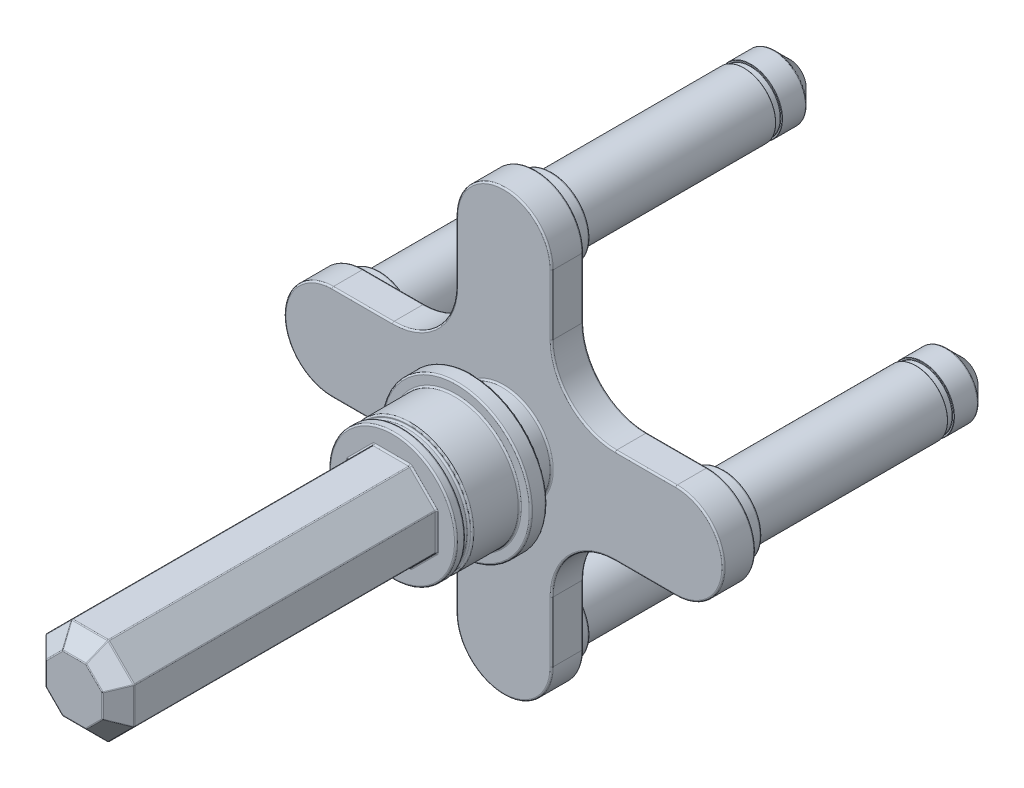
from build123d import *

# Parameters (mm, degrees)
SKETCH1_R           = 5
BOSS_EXTRUDE1_DEPTH = 5
SKETCH2_R           = 4.975
BOSS_EXTRUDE2_DEPTH = 40
SKETCH4_R           = 6
SKETCH4_R_2         = 4.975
BOSS_EXTRUDE3_DEPTH = 2.5
CIRPATTERN1_COUNT   = 4
CHAMFER1_SIZE       = 2.5
FILLET1_R           = 0.25
SKETCH5_R           = 4.975
SKETCH5_R_2         = 4.7
CUT_EXTRUDE1_DEPTH  = 0.5
CIRPATTERN3_COUNT   = 4
FILLET4_R           = 0.05
CUT_EXTRUDE2_DEPTH  = 50
CHAMFER2_SIZE       = 2.5
SKETCH9_R           = 11.75
BOSS_EXTRUDE4_DEPTH = 2.5
FILLET6_R           = 0.25
SKETCH10_R          = 10
SKETCH10_R_2        = 9.4
CUT_EXTRUDE3_DEPTH  = 0.55
FILLET7_R           = 0.25


with BuildPart() as part:
    # Sketch1 → Boss-Extrude1 (new body)
    # profile 1 of 5: a face of its own
    with BuildSketch(Plane.XY):
        with BuildLine():
            Line((-7.5, 17.5), (-7.5, 26.999999944))
            ThreePointArc((-7.5, 26.999999944), (0, 34.499999944), (7.5, 26.999999944))
            Line((7.5, 26.999999944), (7.5, 17.5))
            ThreePointArc((7.5, 17.5), (10.428932188, 10.428932188), (17.5, 7.5))
            Line((17.5, 7.5), (26.999999944, 7.5))
            ThreePointArc((26.999999944, 7.5), (34.499999944, 0), (26.999999944, -7.5))
            Line((26.999999944, -7.5), (17.5, -7.5))
            ThreePointArc((17.5, -7.5), (10.428932188, -10.428932188), (7.5, -17.5))
            Line((7.5, -17.5), (7.5, -26.999999944))
            ThreePointArc((7.5, -26.999999944), (0, -34.499999944), (-7.5, -26.999999944))
            Line((-7.5, -26.999999944), (-7.5, -17.5))
            ThreePointArc((-7.5, -17.5), (-10.428932188, -10.428932188), (-17.5, -7.5))
            Line((-17.5, -7.5), (-26.999999944, -7.5))
            ThreePointArc((-26.999999944, -7.5), (-34.499999944, 0), (-26.999999944, 7.5))
            Line((-26.999999944, 7.5), (-17.5, 7.5))
            ThreePointArc((-17.5, 7.5), (-10.428932188, 10.428932188), (-7.5, 17.5))
        make_face()
        with Locations((0, 26.999999944)):
            Circle(SKETCH1_R, mode=Mode.SUBTRACT)
        with Locations((26.999999944, 0)):
            Circle(SKETCH1_R, mode=Mode.SUBTRACT)
        with Locations((0, -26.999999944)):
            Circle(SKETCH1_R, mode=Mode.SUBTRACT)
        with Locations((-26.999999944, 0)):
            Circle(SKETCH1_R, mode=Mode.SUBTRACT)
    # profile 2 of 5: a face of its own
    with BuildSketch(Plane.XY):
        with Locations((-26.999999944, 0)):
            Circle(SKETCH1_R)
    # profile 3 of 5: a face of its own
    with BuildSketch(Plane.XY):
        with Locations((0, 26.999999944)):
            Circle(SKETCH1_R)
    # profile 4 of 5: a face of its own
    with BuildSketch(Plane.XY):
        with Locations((26.999999944, 0)):
            Circle(SKETCH1_R)
    # profile 5 of 5: a face of its own
    with BuildSketch(Plane.XY):
        with Locations((0, -26.999999944)):
            Circle(SKETCH1_R)
    extrude(amount=BOSS_EXTRUDE1_DEPTH)

    # Sketch2 → Boss-Extrude2 (add)
    with BuildSketch(Plane(origin=(0, 0, 0), x_dir=(-1, 0, 0), z_dir=(0, 0, -1))):
        with Locations(Location((-26.999999888, 5.6e-08, 0), (0, 0, 180))):
            Circle(SKETCH2_R)
        with Locations(Location((0, 27, 0), (0, 0, 180))):
            Circle(SKETCH2_R)
        with Locations(Location((27, 5.6e-08, 0), (0, 0, 180))):
            Circle(SKETCH2_R)
        with Locations(Location((1.12e-07, -26.999999944, 0), (0, 0, 180))):
            Circle(SKETCH2_R)
    extrude(amount=BOSS_EXTRUDE2_DEPTH)

    # Sketch4 → Boss-Extrude3 (add)
    with BuildSketch(Plane(origin=(0, 0, 0), x_dir=(-1, 0, 0), z_dir=(0, 0, -1))):
        with Locations(Location((0, 27, 0), (0, 0, 180))):
            Circle(SKETCH4_R)
        with Locations((0, 27)):
            Circle(SKETCH4_R_2, mode=Mode.SUBTRACT)
    boss_extrude3 = extrude(amount=BOSS_EXTRUDE3_DEPTH)

    # CirPattern1: Boss-Extrude3 ×4 about axis
    cirpattern1_axis = Axis((0, 0, 0), (0, 0, 1))
    for i in range(1, CIRPATTERN1_COUNT):
        add(boss_extrude3.rotate(cirpattern1_axis, i * 360 / CIRPATTERN1_COUNT))

    # Chamfer1
    chamfer1_edges = [part.edges().sort_by_distance(p)[0] for p in [
        (22.024999888, 5.6e-08, -40),
        (-4.975, 27, -40),
        (-31.975, 5.6e-08, -40),
        (-4.975000112, -26.999999944, -40),
    ]]
    chamfer(chamfer1_edges, length=CHAMFER1_SIZE)

    # Fillet1
    fillet1_edges = [part.edges().sort_by_distance(p)[0] for p in [
        (-10.428932188, 10.428932188, 5),
        (-29.475, 5.6e-08, -40),
        (-31.975, 5.6e-08, -37.5),
        (-2.475000112, -26.999999944, -40),
        (-4.975000112, -26.999999944, -37.5),
        (24.524999888, 5.6e-08, -40),
        (22.024999888, 5.6e-08, -37.5),
        (-2.475, 27, -40),
        (-4.975, 27, -37.5),
        (-22.249999972, 7.5, 5),
        (0, 34.499999944, 0),
        (7.5, 22.249999972, 0),
        (10.428932188, 10.428932188, 0),
        (22.249999972, 7.5, 0),
        (34.499999944, 0, 0),
        (-34.499999944, 0, 5),
        (22.249999972, -7.5, 0),
        (10.428932188, -10.428932188, 0),
        (7.5, -22.249999972, 0),
        (0, -34.499999944, 0),
        (-7.5, -22.249999972, 0),
        (-10.428932188, -10.428932188, 0),
        (-22.249999972, -7.5, 0),
        (-34.499999944, 0, 0),
        (-22.249999972, 7.5, 0),
        (-10.428932188, 10.428932188, 0),
        (-22.249999972, -7.5, 5),
        (-7.5, 22.249999972, 0),
        (-10.428932188, -10.428932188, 5),
        (-7.5, -22.249999972, 5),
        (0, -34.499999944, 5),
        (7.5, -22.249999972, 5),
        (-7.5, 22.249999972, 5),
        (10.428932188, -10.428932188, 5),
        (22.249999972, -7.5, 5),
        (34.499999944, 0, 5),
        (22.249999972, 7.5, 5),
        (10.428932188, 10.428932188, 5),
        (-6, 27, -2.5),
        (-4.975, 27, -2.5),
        (7.5, 22.249999972, 5),
        (0, 34.499999944, 5),
        (-27, -6, -2.5),
        (-31.975, -5.6e-08, -2.5),
        (6, -27, -2.5),
        (-4.975, -27, -2.5),
        (27, 6, -2.5),
        (22.025, -5.6e-08, -2.5),
    ]]
    fillet(fillet1_edges, radius=FILLET1_R)

    # Sketch5 → Cut-Extrude1 (cut, symmetric)
    with BuildSketch(Plane(origin=(0, 0, -33.25), x_dir=(-1, 0, 0), z_dir=(0, 0, -1))):
        with Locations(Location((0, 27, 0), (0, 0, 90))):
            Circle(SKETCH5_R)
        with Locations(Location((0, 27, 0), (0, 0, 90))):
            Circle(SKETCH5_R_2, mode=Mode.SUBTRACT)
    cut_extrude1 = extrude(amount=CUT_EXTRUDE1_DEPTH, both=True, mode=Mode.SUBTRACT)

    # CirPattern3: Cut-Extrude1 ×4 about axis
    cirpattern3_axis = Axis((0, 0, 0), (0, 0, 1))
    for i in range(1, CIRPATTERN3_COUNT):
        add(cut_extrude1.rotate(cirpattern3_axis, i * 360 / CIRPATTERN3_COUNT), mode=Mode.SUBTRACT)

    # Fillet4
    fillet4_edges = [part.edges().sort_by_distance(p)[0] for p in [
        (-4.975, 27, -32.75),
        (0, 22.3, -32.75),
        (-4.975, 27, -33.75),
        (0, 22.3, -33.75),
        (22.025, 0, -32.75),
        (22.3, 0, -32.75),
        (22.025, 0, -33.75),
        (22.3, 0, -33.75),
        (-4.975, -27.000000056, -32.75),
        (0, -22.3, -32.75),
        (-4.975, -27.000000056, -33.75),
        (0, -22.3, -33.75),
        (-31.975, -5.6e-08, -32.75),
        (-22.3, 0, -32.75),
        (-31.975, -5.6e-08, -33.75),
        (-22.3, 0, -33.75),
        (-6, 27, 0),
        (-27, -6, 0),
        (6, -27, 0),
        (27, 6, 0),
    ]]
    fillet(fillet4_edges, radius=FILLET4_R)

    # Sketch6 → Revolve1 (revolve)
    with BuildSketch(Plane(origin=(0, 0, 0), x_dir=(0, 0, -1), z_dir=(1, 0, 0)), mode=Mode.PRIVATE) as revolve1_sk:
        Polygon((-5, 7.5), (-12.5, 7.5), (-12.5, 10), (-22.5, 10), (-22.5, 7.5), (-72.5, 7.5), (-72.5, 0), (-5, 0), align=None)
    revolve(revolve1_sk.sketch.rotate(Axis((0, 0, 0.25), (0, 0, 1)), 90), axis=Axis((0, 0, 0.25), (0, 0, 1)))

    # Sketch7 → Cut-Extrude2 (cut)
    with BuildSketch(Plane.XY.offset(72.5)):
        with BuildLine():
            ThreePointArc((-6.929096494, -2.870125743), (-5.303300859, -5.303300859), (-2.870125743, -6.929096494))
            Line((-2.870125743, -6.929096494), (-6.929096494, -2.870125743))
        make_face()
        with BuildLine():
            Line((2.870125743, -6.929096494), (-2.870125743, -6.929096494))
            ThreePointArc((-2.870125743, -6.929096494), (0, -7.5), (2.870125743, -6.929096494))
        make_face()
        with BuildLine():
            Line((6.929096494, -2.870125743), (2.870125743, -6.929096494))
            ThreePointArc((2.870125743, -6.929096494), (5.303300859, -5.303300859), (6.929096494, -2.870125743))
        make_face()
        with BuildLine():
            ThreePointArc((-6.929096494, 2.870125743), (-7.5, 0), (-6.929096494, -2.870125743))
            Line((-6.929096494, -2.870125743), (-6.929096494, 2.870125743))
        make_face()
        with BuildLine():
            Line((6.929096494, 2.870125743), (6.929096494, -2.870125743))
            ThreePointArc((6.929096494, -2.870125743), (7.5, 0), (6.929096494, 2.870125743))
        make_face()
        with BuildLine():
            ThreePointArc((-2.870125743, 6.929096494), (-5.303300859, 5.303300859), (-6.929096494, 2.870125743))
            Line((-6.929096494, 2.870125743), (-2.870125743, 6.929096494))
        make_face()
        with BuildLine():
            Line((2.870125743, 6.929096494), (6.929096494, 2.870125743))
            ThreePointArc((6.929096494, 2.870125743), (5.303300859, 5.303300859), (2.870125743, 6.929096494))
        make_face()
        with BuildLine():
            ThreePointArc((2.870125743, 6.929096494), (0, 7.5), (-2.870125743, 6.929096494))
            Line((-2.870125743, 6.929096494), (2.870125743, 6.929096494))
        make_face()
    extrude(amount=-CUT_EXTRUDE2_DEPTH, mode=Mode.SUBTRACT)

    # Chamfer2
    chamfer2_edges = [part.edges().sort_by_distance(p)[0] for p in [
        (0, -6.929096494, 72.5),
        (6.929096494, 0, 72.5),
        (0, 6.929096494, 72.5),
        (-6.929096494, 0, 72.5),
        (4.899611118, -4.899611118, 72.5),
        (4.899611118, 4.899611118, 72.5),
        (-4.899611118, 4.899611118, 72.5),
        (-4.899611118, -4.899611118, 72.5),
    ]]
    chamfer(chamfer2_edges, length=CHAMFER2_SIZE)

    # Sketch9 → Boss-Extrude4 (add)
    with BuildSketch(Plane.XY.offset(10)):
        with Locations(Location((0, 0, 0), (0, 0, 180))):
            Circle(SKETCH9_R)
    extrude(amount=BOSS_EXTRUDE4_DEPTH)

    # Fillet6
    fillet6_edges = [part.edges().sort_by_distance(p)[0] for p in [
        (7.5, 0, 5),
        (10, 0, 12.5),
        (10, 0, 22.5),
        (0, -6.929096494, 22.5),
        (-2.870125743, -6.929096494, 46.25),
        (2.870125743, -6.929096494, 46.25),
        (6.929096494, 0, 22.5),
        (6.929096494, 2.870125743, 46.25),
        (0, 6.929096494, 22.5),
        (-2.870125743, 6.929096494, 46.25),
        (-6.929096494, 0, 22.5),
        (-6.929096494, -2.870125743, 46.25),
        (4.899611118, -4.899611118, 22.5),
        (6.929096494, -2.870125743, 46.25),
        (4.899611118, 4.899611118, 22.5),
        (2.870125743, 6.929096494, 46.25),
        (-4.899611118, 4.899611118, 22.5),
        (-6.929096494, 2.870125743, 46.25),
        (-4.899611118, -4.899611118, 22.5),
        (-4.429096494, 0, 72.5),
        (-3.131844165, -3.131844165, 72.5),
        (0, -4.429096494, 72.5),
        (3.131844165, -3.131844165, 72.5),
        (4.429096494, 0, 72.5),
        (3.131844165, 3.131844165, 72.5),
        (0, 4.429096494, 72.5),
        (-3.131844165, 3.131844165, 72.5),
        (-4.899611118, 4.899611118, 70),
        (0, 6.929096494, 70),
        (4.899611118, 4.899611118, 70),
        (6.929096494, 0, 70),
        (4.899611118, -4.899611118, 70),
        (0, -6.929096494, 70),
        (-4.899611118, -4.899611118, 70),
        (-6.929096494, 0, 70),
        (5.679096494, -2.35235879, 71.25),
        (2.35235879, -5.679096494, 71.25),
        (5.679096494, 2.35235879, 71.25),
        (-2.35235879, -5.679096494, 71.25),
        (2.35235879, 5.679096494, 71.25),
        (-5.679096494, -2.35235879, 71.25),
        (-2.35235879, 5.679096494, 71.25),
        (-5.679096494, 2.35235879, 71.25),
        (7.5, 0, 10),
        (11.75, 0, 12.5),
        (11.75, 0, 10),
    ]]
    fillet(fillet6_edges, radius=FILLET6_R)

    # Sketch10 → Cut-Extrude3 (cut, symmetric)
    with BuildSketch(Plane.XY.offset(20.5)):
        with Locations(Location((0, 0, 0), (0, 0, 180))):
            Circle(SKETCH10_R)
        Circle(SKETCH10_R_2, mode=Mode.SUBTRACT)
    extrude(amount=CUT_EXTRUDE3_DEPTH, both=True, mode=Mode.SUBTRACT)

    # Fillet7
    fillet7_edges = [part.edges().sort_by_distance(p)[0] for p in [
        (10, 0, 19.95),
        (-9.4, 0, 19.95),
        (10, 0, 21.05),
        (-9.4, 0, 21.05),
    ]]
    fillet(fillet7_edges, radius=FILLET7_R)


solid = part.part
